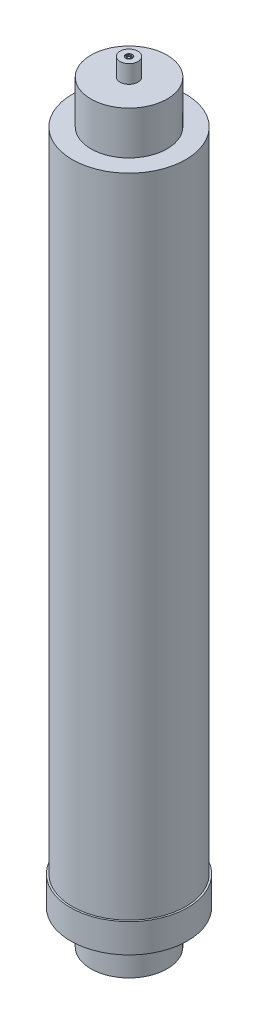
from build123d import *
from build123d.topology import SkipClean

# Parameters (mm, degrees)
SKETCH1_R           = 53.975
BOSS_EXTRUDE1_DEPTH = 48.7426
SKETCH2_R           = 82.931
BOSS_EXTRUDE2_DEPTH = 40.9194
SKETCH3_R           = 80.391
BOSS_EXTRUDE3_DEPTH = 917.194
SKETCH4_R           = 53.975
BOSS_EXTRUDE4_DEPTH = 61.214
SKETCH5_R           = 12.7
BOSS_EXTRUDE5_DEPTH = 25.4
SKETCH6_R           = 4.7625
CUT_EXTRUDE1_DEPTH  = 25.4
THREAD1_PITCH       = 1.5875


with BuildPart() as part:
    # Sketch1 → Boss-Extrude1 (new body)
    with BuildSketch(Plane(origin=(0, 0, 0), x_dir=(1, 0, 0), z_dir=(0, 1, 0))):
        with Locations(Location((0, 0, 0), (0, 0, 90))):
            Circle(SKETCH1_R)
    extrude(amount=BOSS_EXTRUDE1_DEPTH)

    # Sketch2 → Boss-Extrude2 (add)
    with BuildSketch(Plane(origin=(0, 48.7426, 0), x_dir=(1, 0, 0), z_dir=(0, 1, 0))):
        with Locations(Location((0, 0, 0), (0, 0, 90))):
            Circle(SKETCH2_R)
    extrude(amount=BOSS_EXTRUDE2_DEPTH)

    # Sketch3 → Boss-Extrude3 (add)
    with BuildSketch(Plane(origin=(0, 89.662, 0), x_dir=(1, 0, 0), z_dir=(0, 1, 0))):
        with Locations(Location((0, 0, 0), (0, 0, 270))):
            Circle(SKETCH3_R)
    extrude(amount=BOSS_EXTRUDE3_DEPTH)

    # Sketch4 → Boss-Extrude4 (add)
    with BuildSketch(Plane(origin=(0, 1006.856, 0), x_dir=(1, 0, 0), z_dir=(0, 1, 0))):
        with Locations(Location((0, 0, 0), (0, 0, 90))):
            Circle(SKETCH4_R)
    extrude(amount=BOSS_EXTRUDE4_DEPTH)

    # Sketch5 → Boss-Extrude5 (add)
    with BuildSketch(Plane(origin=(0, 1068.07, 0), x_dir=(1, 0, 0), z_dir=(0, 1, 0))):
        with Locations(Location((0, 0, 0), (0, 0, 270))):
            Circle(SKETCH5_R)
    extrude(amount=BOSS_EXTRUDE5_DEPTH)

    # Sketch6 → Cut-Extrude1 (cut)
    with BuildSketch(Plane(origin=(0, 1093.47, 0), x_dir=(1, 0, 0), z_dir=(0, 1, 0))):
        with Locations(Location((0, 0, 0), (0, 0, 270))):
            Circle(SKETCH6_R)
    extrude(amount=-CUT_EXTRUDE1_DEPTH, mode=Mode.SUBTRACT)

    # Thread1: the profile of Thread Profile1 profile screwed along a right-hand helix of 16 turns, 8 arcs to a turn; built about Z, then put on its axis
    with SkipClean():  # the faces are left unmerged after this step: merging them gives an invalid solid
        thread1_z = Axis((0, 0, 0), (0, 0, 1))
        thread1_corners = [(4.7628, 0, -0.000173205), (4.7628, 0, 1.389235701), (3.903240423, 0, 0.892968748), (3.903240423, 0, 0.496093748)]
        with BuildLine(mode=Mode.PRIVATE) as thread1_profile:
            Line(thread1_corners[0], thread1_corners[1])
            Line(thread1_corners[1], thread1_corners[2])
            Line(thread1_corners[2], thread1_corners[3])
            Line(thread1_corners[3], thread1_corners[0])
        thread1_cap = Face(thread1_profile.wire())
        thread1_turn_angles = [0, 22.5, 45, 67.5, 90, 112.5, 135, 157.5, 180, 202.5, 225, 247.5, 270, 292.5, 315, 337.5, 360]
        thread1_turn_weights = [1, 0.9238795325112867, 1, 0.9238795325112867, 1, 0.9238795325112867, 1, 0.9238795325112867, 1, 0.9238795325112867, 1, 0.9238795325112867, 1, 0.9238795325112867, 1, 0.9238795325112867, 1]
        thread1_turn_rails = [Edge.make_bspline([Vector(p[0], p[1], 0).rotate(thread1_z, thread1_turn_angles[k]) / thread1_turn_weights[k] + Vector(0, 0, p[2] + THREAD1_PITCH * thread1_turn_angles[k] / 360) for k in range(17)], [0, 0, 0, 1, 1, 2, 2, 3, 3, 4, 4, 5, 5, 6, 6, 7, 7, 8, 8, 8], 2, thread1_turn_weights) for p in thread1_corners]
        thread1_turn_sides = [Face.make_surface_from_curves(thread1_turn_rails[p[0]], thread1_turn_rails[p[1]]) for p in [(0, 1), (1, 2), (2, 3), (3, 0)]]
        thread1 = Plane(origin=(0, 1093.47, 0), x_dir=(-1, 0, 0), z_dir=(0, -1, 0)) * Solid(Shell([*[p.moved(Location((0, 0, THREAD1_PITCH * i))) for i in range(16) for p in thread1_turn_sides], thread1_cap, thread1_cap.rotate(thread1_z, 5760).moved(Location((0, 0, THREAD1_PITCH * 5760 / 360)))]))
        add(thread1)


solid = part.part
